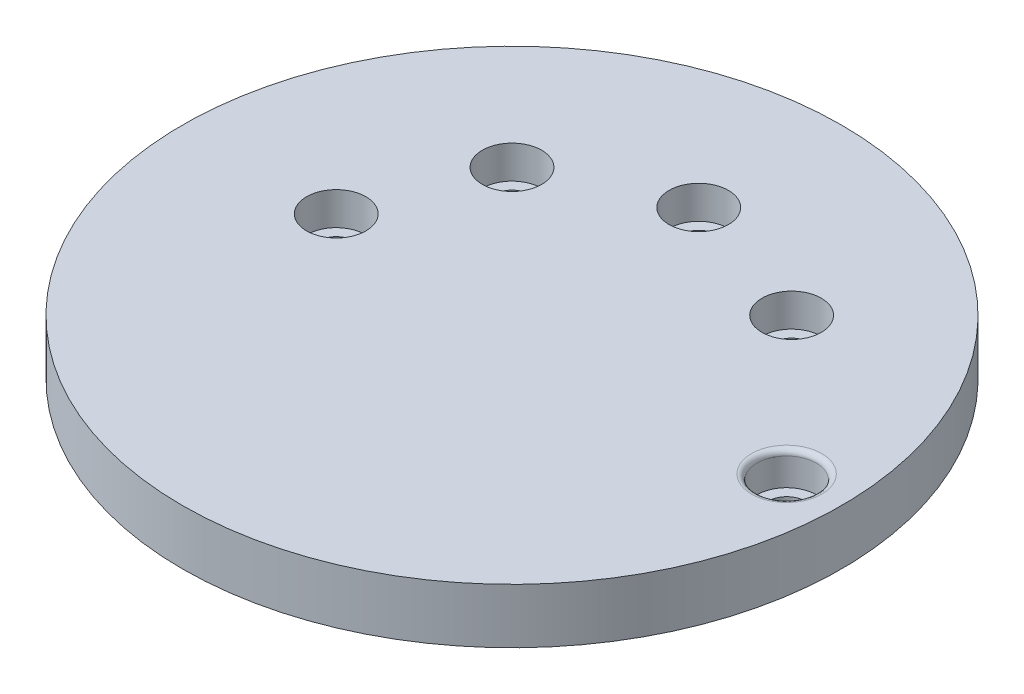
from build123d import *

# Parameters (mm, degrees)
SKETCH1_R               = 38.1
BOSS_EXTRUDE1_DEPTH     = 6.35
CUT_EXTRUDE1_DEPTH      = 55.254423783
CUT_EXTRUDE1_DEPTH_BACK = 3.81
SKETCH2_R               = 3.429
CUT_EXTRUDE2_DEPTH      = 55.254423783
CUT_EXTRUDE2_DEPTH_BACK = 55.254423783
SKETCH2_3_R             = 2.159
SKETCH4_R               = 6.910573657
BOSS_EXTRUDE2_DEPTH     = 1.27
BOSS_EXTRUDE3_START     = 3.81
SKETCH5_R               = 6.35
BOSS_EXTRUDE3_DEPTH     = 3.81
FILLET1_R               = 3.81
FILLET2_R               = 0.635


with BuildPart() as part:
    # Sketch1 → Boss-Extrude1 (new body)
    with BuildSketch(Plane(origin=(0, 0, 0), x_dir=(1, 0, 0), z_dir=(0, 1, 0))):
        with Locations(Location((0, 0, 0), (0, 0, 270))):
            Circle(SKETCH1_R)
        with BuildLine():
            Line((-1.786407019, 2.487499957), (1.786407019, 2.487499957))
            ThreePointArc((1.786407019, 2.487499957), (0, -3.062499971), (-1.786407019, 2.487499957))
        make_face(mode=Mode.SUBTRACT)
    extrude(amount=BOSS_EXTRUDE1_DEPTH)

    # Sketch2 → Cut-Extrude1 (cut, two sides: drawn at the far end of the back side and taken through both)
    with BuildSketch(Plane(origin=(0, 6.35, 0), x_dir=(1, 0, 0), z_dir=(0, 1, 0)).offset(-CUT_EXTRUDE1_DEPTH_BACK)):
        with Locations(Location((-20.32, 0, 0), (0, 0, 90))):
            Circle(SKETCH2_R)
        with Locations(Location((-14.8174226, 14.8174226, 0), (0, 0, 90))):
            Circle(SKETCH2_R)
        with Locations(Location((0, 21.59, 0), (0, 0, 90))):
            Circle(SKETCH2_R)
        with Locations(Location((16.164461018, 16.164461018, 0), (0, 0, 90))):
            Circle(SKETCH2_R)
        with Locations(Location((31.75, 0, 0), (0, 0, 90))):
            Circle(SKETCH2_R)
    extrude(amount=CUT_EXTRUDE1_DEPTH + CUT_EXTRUDE1_DEPTH_BACK, mode=Mode.SUBTRACT)

    # Sketch2<3> → Cut-Extrude2 (cut, two sides: drawn at the far end of the back side and taken through both)
    with BuildSketch(Plane(origin=(0, 6.35, 0), x_dir=(1, 0, 0), z_dir=(0, 1, 0)).offset(-CUT_EXTRUDE2_DEPTH_BACK)):
        with Locations(Location((-20.32, 0, 0), (0, 0, 270))):
            Circle(SKETCH2_3_R)
        with Locations(Location((-14.8174226, 14.8174226, 0), (0, 0, 270))):
            Circle(SKETCH2_3_R)
        with Locations(Location((0, 21.59, 0), (0, 0, 270))):
            Circle(SKETCH2_3_R)
        with Locations(Location((16.164461018, 16.164461018, 0), (0, 0, 270))):
            Circle(SKETCH2_3_R)
        with Locations(Location((31.75, 0, 0), (0, 0, 270))):
            Circle(SKETCH2_3_R)
    extrude(amount=CUT_EXTRUDE2_DEPTH + CUT_EXTRUDE2_DEPTH_BACK, mode=Mode.SUBTRACT)

    # Sketch4 → Boss-Extrude2 (add)
    with BuildSketch(Plane(origin=(0, 6.35, 0), x_dir=(1, 0, 0), z_dir=(0, 1, 0))):
        Circle(SKETCH4_R)
    extrude(amount=-BOSS_EXTRUDE2_DEPTH)

    # Sketch5 → Boss-Extrude3 (add)
    with BuildSketch(Plane.XZ.offset(BOSS_EXTRUDE3_START)):
        with Locations(Location((0, 0, 0), (0, 0, 90))):
            Circle(SKETCH5_R)
        with BuildLine():
            Line((-1.786407019, -2.487499957), (1.786407019, -2.487499957))
            ThreePointArc((1.786407019, -2.487499957), (0, 3.062499971), (-1.786407019, -2.487499957))
        make_face(mode=Mode.SUBTRACT)
    extrude(amount=-BOSS_EXTRUDE3_DEPTH)

    # Fillet1
    fillet1_edges = [part.edges().sort_by_distance(p)[0] for p in [
        (0, 0, -6.35),
    ]]
    fillet(fillet1_edges, radius=FILLET1_R - 0.0001)  # a hair under: the kernel refuses the full size

    # Fillet2
    fillet2_edges = [part.edges().sort_by_distance(p)[0] for p in [
        (31.75, 6.35, 3.429),
    ]]
    fillet(fillet2_edges, radius=FILLET2_R)


solid = part.part
